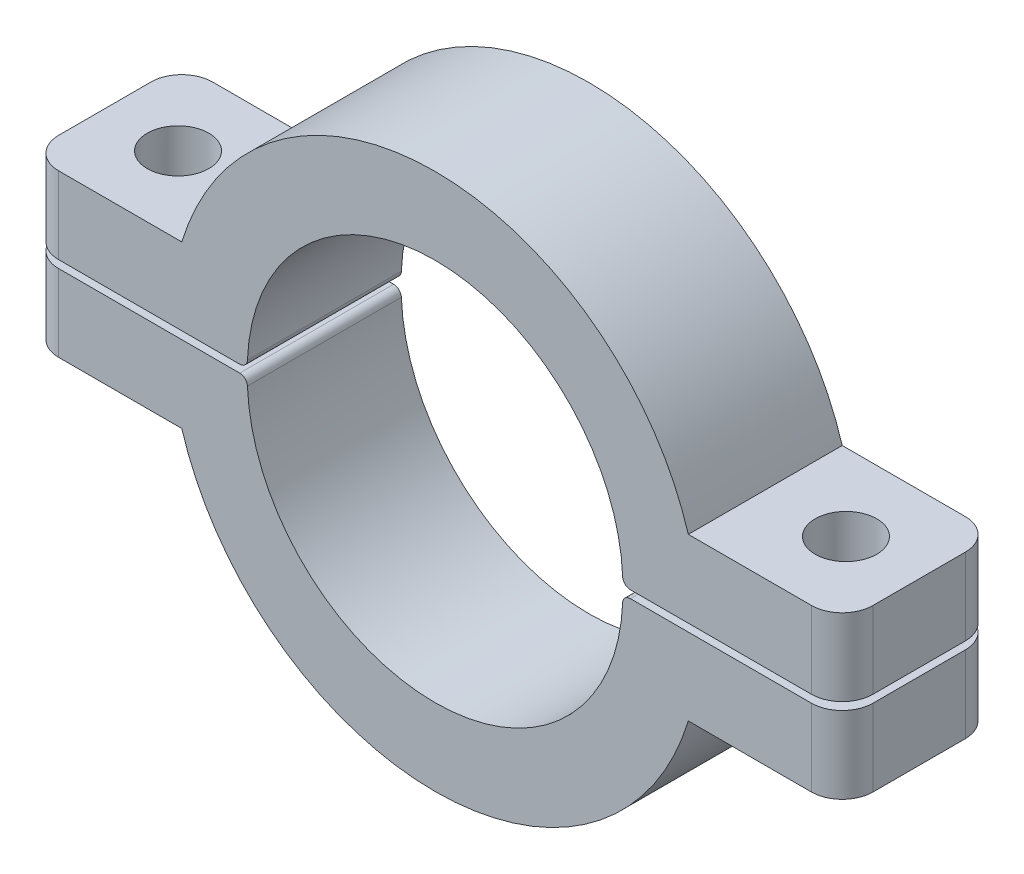
from build123d import *

# Parameters (mm, degrees)
BOSS_EXTRUDE1_DEPTH     = 10
FILLET1_R               = 2
FILLET3_R               = 0.5
CUT_EXTRUDE1_DEPTH      = 34.233820804
CUT_EXTRUDE1_DEPTH_BACK = 34.233820804
SKETCH3_R               = 2


with BuildPart() as part:
    # Sketch1 → Boss-Extrude1 (new body)
    with BuildSketch(Plane.XY):
        with BuildLine():
            Line((-26.457217262, 0.25), (-12.2, 0.25))
            ThreePointArc((-12.2, 0.25), (0, 12.45), (12.2, 0.25))
            Line((12.2, 0.25), (26.457217262, 0.25))
            Line((26.457217262, 0.25), (26.457217262, 5.25))
            Line((26.457217262, 5.25), (16.457217262, 5.25))
            ThreePointArc((16.457217262, 5.25), (0, 17.45), (-16.457217262, 5.25))
            Line((-16.457217262, 5.25), (-26.457217262, 5.25))
            Line((-26.457217262, 5.25), (-26.457217262, 0.25))
        make_face()
    extrude(amount=BOSS_EXTRUDE1_DEPTH)

    # Fillet1
    fillet1_edges = [part.edges().sort_by_distance(p)[0] for p in [
        (26.457217262, 2.75, 0),
        (-26.457217262, 2.75, 0),
        (26.457217262, 2.75, 10),
        (-26.457217262, 2.75, 10),
    ]]
    fillet(fillet1_edges, radius=FILLET1_R)

    # Fillet3
    fillet3_edges = [part.edges().sort_by_distance(p)[0] for p in [
        (-12.2, 0.25, 5),
        (12.2, 0.25, 5),
    ]]
    fillet(fillet3_edges, radius=FILLET3_R)


with BuildPart() as body_2:
    # Mirror3: mirrored copy
    add(part.part.mirror(Plane.ZX))


with BuildPart() as cut_extrude1_tool:
    # Sketch3 → Cut-Extrude1 (new, two sides: drawn at the far end of the back side and taken through both)
    with BuildSketch(Plane(origin=(0, 0, 0), x_dir=(1, 0, 0), z_dir=(0, 1, 0)).offset(-CUT_EXTRUDE1_DEPTH_BACK)):
        with Locations((-21.7, -5)):
            Circle(SKETCH3_R)
        with Locations((21.7, -5)):
            Circle(SKETCH3_R)
    extrude(amount=CUT_EXTRUDE1_DEPTH + CUT_EXTRUDE1_DEPTH_BACK)


with BuildPart() as part_1:
    add(part.part)

    # Cut-Extrude1: cut by cut_extrude1_tool
    add(cut_extrude1_tool.part, mode=Mode.SUBTRACT)


with BuildPart() as body_2_1:
    add(body_2.part)

    # Cut-Extrude1: cut by cut_extrude1_tool
    add(cut_extrude1_tool.part, mode=Mode.SUBTRACT)


solid = Compound([part_1.part, body_2_1.part])
